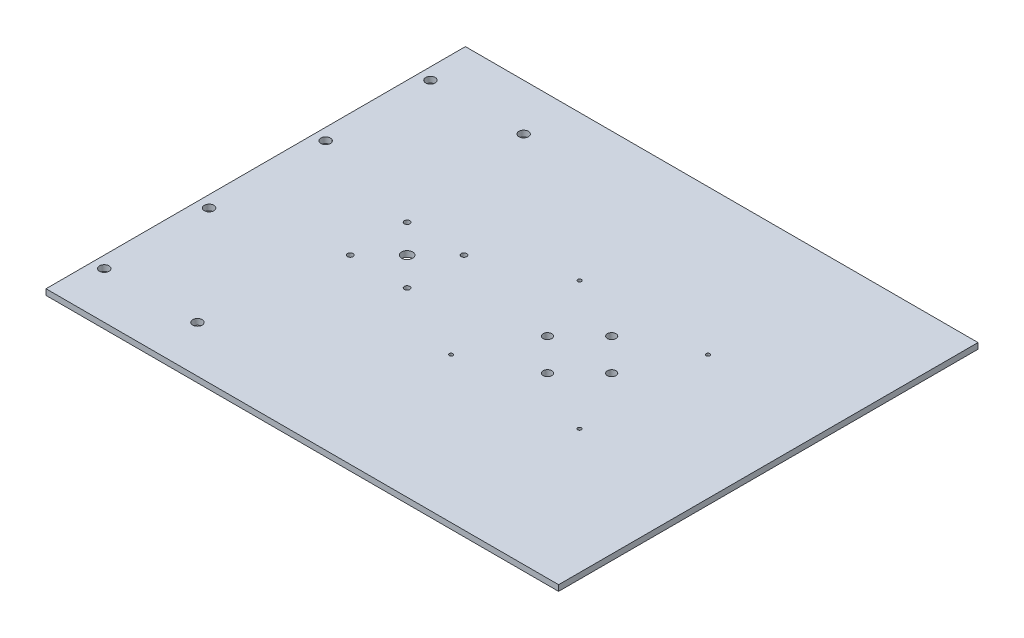
from build123d import *

# Parameters (mm, degrees)
SKETCH1_W           = 279.4
SKETCH1_H           = 228.6
BOSS_EXTRUDE1_DEPTH = 3.175
SKETCH3_R           = 2.600000007
CUT_EXTRUDE1_DEPTH  = 181.528835993
SKETCH5_R           = 1.5
SKETCH5_R_2         = 3.007999953
CUT_EXTRUDE2_DEPTH  = 181.528835993
SKETCH7_R           = 0.999998
CUT_EXTRUDE3_DEPTH  = 181.528835993
SKETCH8_R           = 2.35
CUT_EXTRUDE4_DEPTH  = 181.528835993


with BuildPart() as part:
    # Sketch1 → Boss-Extrude1 (new body)
    with BuildSketch(Plane(origin=(0, 0, 0), x_dir=(1, 0, 0), z_dir=(0, 1, 0))):
        Rectangle(SKETCH1_W, SKETCH1_H)
    extrude(amount=BOSS_EXTRUDE1_DEPTH)

    # Sketch3 → Cut-Extrude1 (cut, through all)
    with BuildSketch(Plane(origin=(0, 3.175, 0), x_dir=(1, 0, 0), z_dir=(0, 1, 0))):
        with Locations((-133.35, -31.75)):
            Circle(SKETCH3_R)
        with Locations((-82.55, -88.9)):
            Circle(SKETCH3_R)
        with Locations((-133.35, -88.9)):
            Circle(SKETCH3_R)
    cut_extrude1 = extrude(amount=-CUT_EXTRUDE1_DEPTH, mode=Mode.SUBTRACT)

    # Mirror1: Cut-Extrude1 across plane
    add(cut_extrude1.mirror(Plane.XY), mode=Mode.SUBTRACT)

    # Sketch5 → Cut-Extrude2 (cut, through all)
    with BuildSketch(Plane(origin=(0, 3.175, 0), x_dir=(1, 0, 0), z_dir=(0, 1, 0))):
        with Locations((-41.674, 15.5)):
            Circle(SKETCH5_R)
        with Locations((-41.674, -15.5)):
            Circle(SKETCH5_R)
        with Locations((-72.674, 15.5)):
            Circle(SKETCH5_R)
        with Locations((-72.674, -15.5)):
            Circle(SKETCH5_R)
        with Locations((-57.174, 0)):
            Circle(SKETCH5_R_2)
    extrude(amount=-CUT_EXTRUDE2_DEPTH, mode=Mode.SUBTRACT)

    # Sketch7 → Cut-Extrude3 (cut, through all)
    with BuildSketch(Plane(origin=(0, 3.175, 0), x_dir=(1, 0, 0), z_dir=(0, 1, 0))):
        with Locations((71.831787507, -35.001787507)):
            Circle(SKETCH7_R)
        with Locations((1.828212493, -35.001787507)):
            Circle(SKETCH7_R)
        with Locations((1.828212493, 35.001787507)):
            Circle(SKETCH7_R)
        with Locations((71.831787507, 35.001787507)):
            Circle(SKETCH7_R)
    extrude(amount=-CUT_EXTRUDE3_DEPTH, mode=Mode.SUBTRACT)

    # Sketch8 → Cut-Extrude4 (cut, through all)
    with BuildSketch(Plane(origin=(0, 3.175, 0), x_dir=(1, 0, 0), z_dir=(0, 1, 0))):
        with Locations((19.33, 0)):
            Circle(SKETCH8_R)
        with Locations((54.33, 0)):
            Circle(SKETCH8_R)
        with BuildLine():
            ThreePointArc((36.83, -19.85), (39.18, -17.5), (36.83, -15.15))
            ThreePointArc((36.83, -15.15), (34.48, -17.5), (36.83, -19.85))
        make_face()
        with BuildLine():
            ThreePointArc((36.83, 15.15), (39.18, 17.5), (36.83, 19.85))
            ThreePointArc((36.83, 19.85), (34.48, 17.5), (36.83, 15.15))
        make_face()
    extrude(amount=-CUT_EXTRUDE4_DEPTH, mode=Mode.SUBTRACT)


solid = part.part
